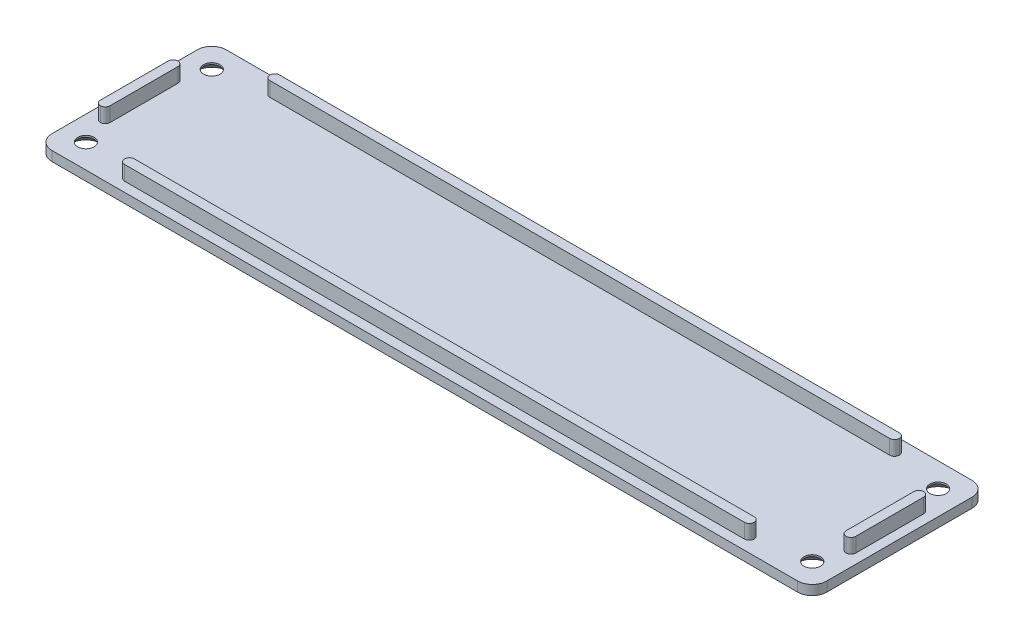
from build123d import *

# Parameters (mm, degrees)
SKETCH1_W                    = 160
SKETCH1_H                    = 36
BOSS_EXTRUDE1_DEPTH          = 2
SKETCH2_W                    = 130
SKETCH2_H                    = 2
SKETCH2_W_2                  = 2
SKETCH2_H_2                  = 16
BOSS_EXTRUDE2_DEPTH          = 3
CSK_FOR_M3_SFHCS1_AT_2_COUNT = 2
CSK_FOR_M3_SFHCS1_AT_2_PITCH = 26
CIRPATTERN1_COUNT            = 2
FILLET1_R                    = 3
FILLET2_R                    = 1


with BuildPart() as part:
    # Sketch1 → Boss-Extrude1 (new body)
    with BuildSketch(Plane(origin=(0, 0, 0), x_dir=(1, 0, 0), z_dir=(0, 1, 0))):
        Rectangle(SKETCH1_W, SKETCH1_H)
    extrude(amount=BOSS_EXTRUDE1_DEPTH)

    # Sketch2 → Boss-Extrude2 (add)
    with BuildSketch(Plane(origin=(0, 2, 0), x_dir=(1, 0, 0), z_dir=(0, 1, 0))):
        with Locations((0, 15)):
            Rectangle(SKETCH2_W, SKETCH2_H)
        with Locations((77, 0)):
            Rectangle(SKETCH2_W_2, SKETCH2_H_2)
    boss_extrude2 = extrude(amount=BOSS_EXTRUDE2_DEPTH)

    # Sketch7 → CSK for M3 SFHCS1 (revolve, cut)
    with BuildSketch(Plane(origin=(75, 0, -13), x_dir=(0, 0, -1), z_dir=(1, 0, 0))):
        Polygon((0, 0), (0, 11.021463052), (1.7, 10), (1.7, 1.66), (3.36, 0), align=None)
    csk_for_m3_sfhcs1 = revolve(axis=Axis((75, -6.35, -13), (0, 1, 0)), mode=Mode.SUBTRACT)

    # CSK for M3 SFHCS1 at 2: CSK for M3 SFHCS1 ×2
    with Locations(*[(0, 0, i * CSK_FOR_M3_SFHCS1_AT_2_PITCH) for i in range(1, CSK_FOR_M3_SFHCS1_AT_2_COUNT)]):
        add(csk_for_m3_sfhcs1, mode=Mode.SUBTRACT)

    # CirPattern1: Boss-Extrude2, CSK for M3 SFHCS1 ×2 about axis
    cirpattern1_axis = Axis((0, 0, 0), (0, 1, 0))
    add([boss_extrude2.rotate(cirpattern1_axis, i * 360 / CIRPATTERN1_COUNT) for i in range(1, CIRPATTERN1_COUNT)])
    add([csk_for_m3_sfhcs1.rotate(cirpattern1_axis, i * 360 / CIRPATTERN1_COUNT) for i in range(1, CIRPATTERN1_COUNT)], mode=Mode.SUBTRACT)

    # CirPattern1 copy 1 sketch → CirPattern1 copy 1 (revolve, cut)
    with BuildSketch(Plane(origin=(-75, 0, -13), x_dir=(0, 0, 1), z_dir=(-1, 0, 0))):
        Polygon((0, 0), (0, 11.021463052), (1.7, 10), (1.7, 1.66), (3.36, 0), align=None)
    revolve(axis=Axis((-75, -6.35, -13), (0, 1, 0)), mode=Mode.SUBTRACT)

    # Fillet1
    fillet1_edges = [part.edges().sort_by_distance(p)[0] for p in [
        (-80, 1, -18),
        (80, 1, -18),
        (80, 1, 18),
        (-80, 1, 18),
    ]]
    fillet(fillet1_edges, radius=FILLET1_R)

    # Fillet2
    fillet2_edges = [part.edges().sort_by_distance(p)[0] for p in [
        (-78, 3.5, -8),
        (-78, 3.5, 8),
        (-76, 3.5, 8),
        (-76, 3.5, -8),
        (-65, 3.5, 14),
        (-65, 3.5, 16),
        (65, 3.5, 16),
        (65, 3.5, 14),
        (78, 3.5, 8),
        (78, 3.5, -8),
        (76, 3.5, -8),
        (76, 3.5, 8),
        (65, 3.5, -14),
        (65, 3.5, -16),
        (-65, 3.5, -16),
        (-65, 3.5, -14),
    ]]
    fillet(fillet2_edges, radius=FILLET2_R - 0.0001)  # a hair under: the kernel refuses the full size


solid = part.part
